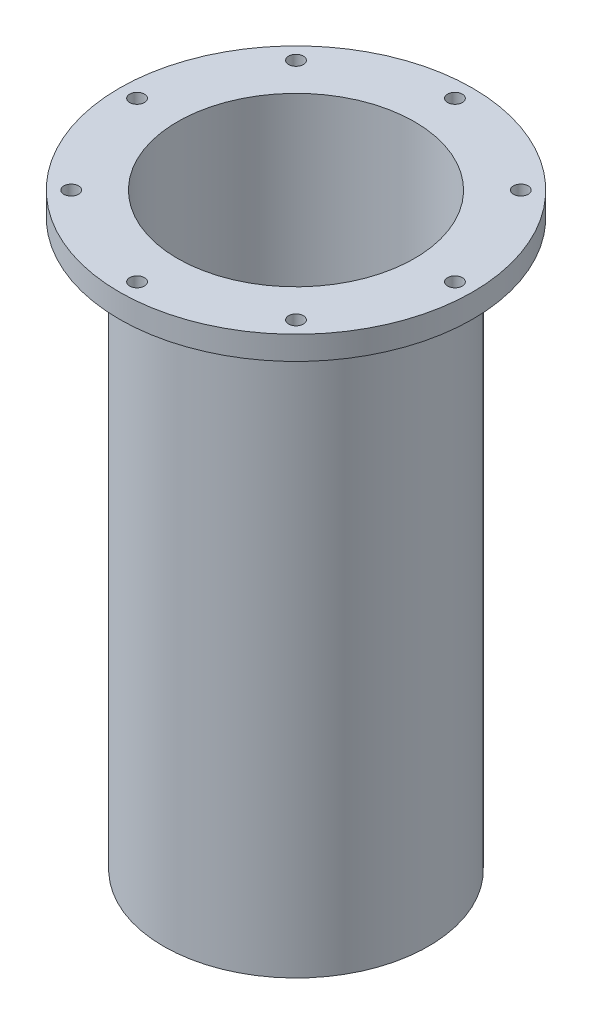
from build123d import *

# Parameters (mm, degrees)
BOLT_HOLES_PROFILE_R = 3.175
BOLT_HOLES_DEPTH     = 276.914624476


with BuildPart() as part:
    # Shell Profile → Shell Revolve (revolve)
    with BuildSketch(Plane.XY):
        Polygon((51.1302, 0), (51.1302, 254), (76.2, 254), (76.2, 243.84), (57.15, 243.84), (57.15, 0), align=None)
    revolve(axis=Axis((0, 0, 0), (0, -1, 0)))

    # Bolt Holes Profile → Bolt Holes (cut, through all)
    with BuildSketch(Plane(origin=(0, 254, 0), x_dir=(1, 0, 0), z_dir=(0, 1, 0))):
        with Locations((0, 68.58)):
            Circle(BOLT_HOLES_PROFILE_R)
        with Locations((48.493383054, 48.493383054)):
            Circle(BOLT_HOLES_PROFILE_R)
        with Locations((68.58, 0)):
            Circle(BOLT_HOLES_PROFILE_R)
        with Locations((48.493383054, -48.493383054)):
            Circle(BOLT_HOLES_PROFILE_R)
        with Locations((0, -68.58)):
            Circle(BOLT_HOLES_PROFILE_R)
        with Locations((-48.493383054, -48.493383054)):
            Circle(BOLT_HOLES_PROFILE_R)
        with Locations((-68.58, 0)):
            Circle(BOLT_HOLES_PROFILE_R)
        with Locations((-48.493383054, 48.493383054)):
            Circle(BOLT_HOLES_PROFILE_R)
    extrude(amount=-BOLT_HOLES_DEPTH, mode=Mode.SUBTRACT)


solid = part.part
